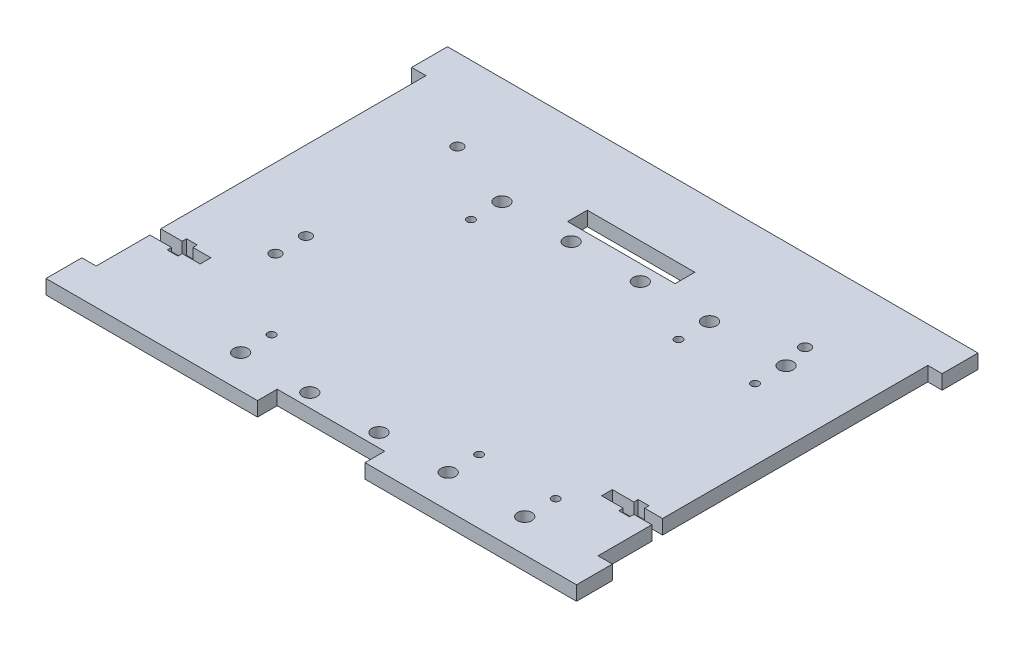
from build123d import *

# Parameters (mm, degrees)
SKETCH1_R           = 1.5
SKETCH1_R_2         = 1.08
SKETCH1_R_3         = 2
SKETCH1_W           = 30
SKETCH1_H           = 5.5
BOSS_EXTRUDE1_DEPTH = 4


with BuildPart() as part:
    # Sketch1 → Boss-Extrude1 (new body)
    with BuildSketch(Plane(origin=(0, 0, 0), x_dir=(1, 0, 0), z_dir=(0, 1, 0))):
        Polygon((85, 0), (140, 0), (144, 0), (144, 10), (140, 10), (140, 25), (135, 25), (135, 23.8), (132, 23.8), (132, 25), (126, 25), (126, 28), (132, 28), (132, 29.2), (135, 29.2), (135, 28), (140, 28), (140, 102), (144, 102), (144, 112), (140, 112), (0, 112), (-4, 112), (-4, 102), (0, 102), (0, 28), (6, 28), (6, 29.2), (9, 29.2), (9, 28), (14, 28), (14, 25), (9, 25), (9, 23.8), (6, 23.8), (6, 25), (0, 25), (0, 10), (-4, 10), (-4, 0), (0, 0), (27, 0), (30.5, 0), (55, 0), (55, 5.5), (85, 5.5), align=None)
        with Locations((22, 46.5)):
            Circle(SKETCH1_R, mode=Mode.SUBTRACT)
        with Locations((118.5, 89.25)):
            Circle(SKETCH1_R, mode=Mode.SUBTRACT)
        with Locations((21.5, 89.25)):
            Circle(SKETCH1_R, mode=Mode.SUBTRACT)
        with Locations((41.05, 73.5)):
            Circle(SKETCH1_R_2, mode=Mode.SUBTRACT)
        with Locations((98.95, 73.5)):
            Circle(SKETCH1_R_2, mode=Mode.SUBTRACT)
        with Locations((41.05, 17.89)):
            Circle(SKETCH1_R_2, mode=Mode.SUBTRACT)
        with Locations((98.95, 17.89)):
            Circle(SKETCH1_R_2, mode=Mode.SUBTRACT)
        with Locations((41.05, 9.245)):
            Circle(SKETCH1_R_3, mode=Mode.SUBTRACT)
        with Locations((60.35, 9.245)):
            Circle(SKETCH1_R_3, mode=Mode.SUBTRACT)
        with Locations((79.65, 9.245)):
            Circle(SKETCH1_R_3, mode=Mode.SUBTRACT)
        with Locations((98.95, 9.245)):
            Circle(SKETCH1_R_3, mode=Mode.SUBTRACT)
        with Locations((41.05, 82.15)):
            Circle(SKETCH1_R_3, mode=Mode.SUBTRACT)
        with Locations((60.35, 82.15)):
            Circle(SKETCH1_R_3, mode=Mode.SUBTRACT)
        with Locations((79.65, 82.15)):
            Circle(SKETCH1_R_3, mode=Mode.SUBTRACT)
        with Locations((98.95, 82.15)):
            Circle(SKETCH1_R_3, mode=Mode.SUBTRACT)
        with Locations((22, 38)):
            Circle(SKETCH1_R, mode=Mode.SUBTRACT)
        with Locations((120.3, 73.5)):
            Circle(SKETCH1_R_2, mode=Mode.SUBTRACT)
        with Locations((120.3, 82.15)):
            Circle(SKETCH1_R_3, mode=Mode.SUBTRACT)
        with Locations((120.3, 17.89)):
            Circle(SKETCH1_R_2, mode=Mode.SUBTRACT)
        with Locations((120.3, 9.245)):
            Circle(SKETCH1_R_3, mode=Mode.SUBTRACT)
        with Locations((70, 89.25)):
            Rectangle(SKETCH1_W, SKETCH1_H, mode=Mode.SUBTRACT)
    extrude(amount=BOSS_EXTRUDE1_DEPTH)


solid = part.part
